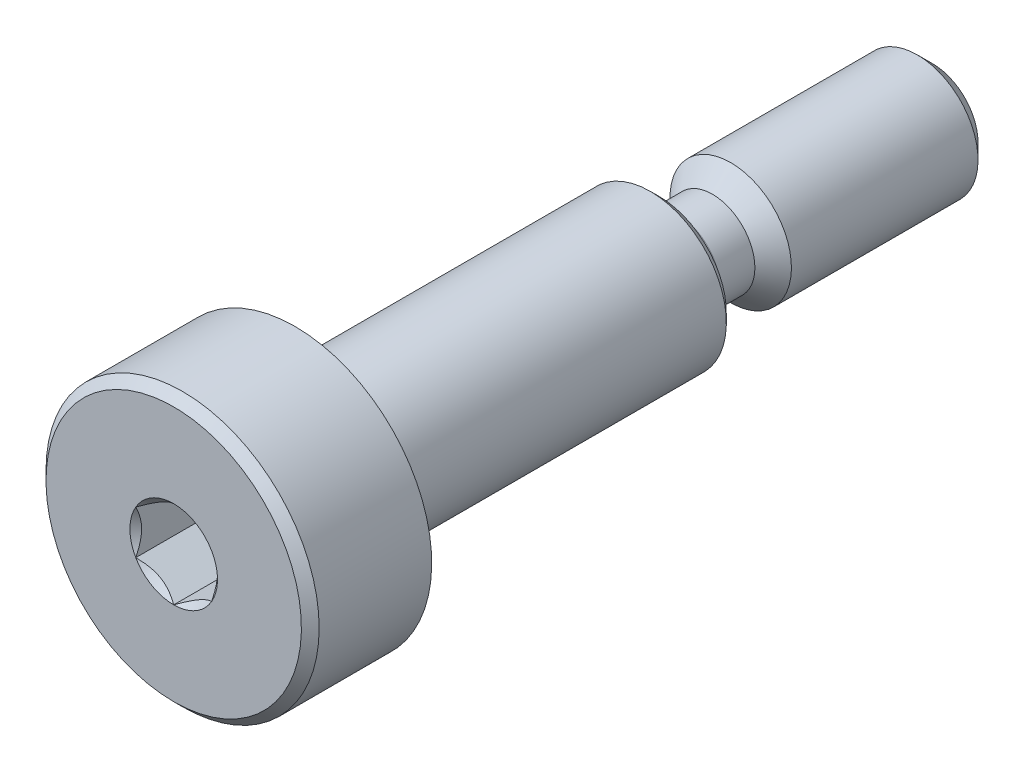
from build123d import *

# Parameters (mm, degrees)
SKETCH4_W           = 0.6
SKETCH4_H           = 0.6
CHAMFER1_SIZE       = 0.1625
CHAMFER2_SIZE       = 0.5
CHAMFER3_SIZE       = 0.2925
CUT_EXTRUDE1_DEPTH  = 2
SPLIT2_START        = -3.2075
SPLIT2_OUTLINE_R    = 4.5
SPLIT2_DEPTH        = 15.7075
SPLIT2_START_2      = 10.5
SPLIT2_3_DEPTH      = 2
SPLIT2_10_OUTLINE_R = 2.5
SPLIT2_10_DEPTH     = 10.945


with BuildPart() as part:
    # Sketch3 → Revolve1 (revolve)
    with BuildSketch(Plane(origin=(0, 0, 0), x_dir=(0, 0, -1), z_dir=(1, 0, 0))):
        Polygon((-12.5, 4.5), (-8.5, 4.5), (-8.5, 2.5), (3.5, 2.5), (3.5, 2), (12.5, 2), (12.5, 0), (-12.5, 0), align=None)
    revolve(axis=Axis((0, 0, -12.5), (0, 0, 1)))

    # Sketch4 → Cut-Revolve1 (revolve, cut)
    with BuildSketch(Plane(origin=(0, 0, 0), x_dir=(0, 0, -1), z_dir=(1, 0, 0))):
        with Locations((-8.2, 2.2)):
            Rectangle(SKETCH4_W, SKETCH4_H)
    revolve(axis=Axis((0, 0, -12.5), (0, 0, 1)), mode=Mode.SUBTRACT)

    # Chamfer1
    chamfer1_edges = [part.edges().sort_by_distance(p)[0] for p in [
        (0, -1.9, 7.9),
        (0, -2.5, 7.9),
    ]]
    chamfer(chamfer1_edges, length=CHAMFER1_SIZE)

    # Sketch6 → Cut-Revolve2 (revolve, cut)
    with BuildSketch(Plane(origin=(0, 0, 0), x_dir=(0, 0, -1), z_dir=(1, 0, 0))):
        with BuildLine():
            Line((3.5, 2.5), (6.352, 2.5))
            Line((6.352, 2.5), (5.25, 1.398))
            Line((5.25, 1.398), (4.102, 1.398))
            ThreePointArc((4.102, 1.398), (3.676321718, 1.574321718), (3.5, 2))
            Line((3.5, 2), (3.5, 2.5))
        make_face()
    revolve(axis=Axis((0, 0, -12.5), (0, 0, 1)), mode=Mode.SUBTRACT)

    # Chamfer2
    chamfer2_edges = [part.edges().sort_by_distance(p)[0] for p in [
        (0, -2, -12.5),
    ]]
    chamfer(chamfer2_edges, length=CHAMFER2_SIZE)

    # Chamfer3
    chamfer3_edges = [part.edges().sort_by_distance(p)[0] for p in [
        (0, -2.5, -3.5),
        (0, -4.5, 12.5),
    ]]
    chamfer(chamfer3_edges, length=CHAMFER3_SIZE)

    # Sketch8 → Cut-Extrude1 (cut)
    with BuildSketch(Plane.XY.offset(12.5)):
        Polygon((1.25, 0.721687836), (0, 1.443375673), (-1.25, 0.721687836), (-1.25, -0.721687836), (0, -1.443375673), (1.25, -0.721687836), align=None)
    extrude(amount=-CUT_EXTRUDE1_DEPTH, mode=Mode.SUBTRACT)

    # Cut-Extrude2 cone 1 section (through the dimple's axis) → Cut-Extrude2 (revolve, cut)
    with BuildSketch(Plane(origin=(0, 0, 12.5), x_dir=(0, -1, 0), z_dir=(1, 0, 0))):
        Polygon((0, 0), (1.443375673, 0), (0, 1.443375673), align=None)
    revolve(axis=Axis((0, 0, 12.5), (0, 0, -1)), mode=Mode.SUBTRACT)

    # Split2: read off the stored shape, not the designer's step
    # Split2 outline → Split2 (cut)
    with BuildSketch(Plane.XY.offset(SPLIT2_START)):
        Circle(SPLIT2_OUTLINE_R)
    extrude(amount=SPLIT2_DEPTH, mode=Mode.SUBTRACT)


with BuildPart() as body_2:
    # Split2 2 outline → Split2 2 (revolve)
    with BuildSketch(Plane.XZ):
        Polygon((0, 12.500000022), (0, 7.7375), (2.5, 7.7375), (2.3375, 7.9), (2.0625, 7.9), (1.9, 8.0625), (1.9, 8.5), (4.5, 8.5), (4.5, 12.2075), (4.2075, 12.5), (1.443375689, 12.500000017), align=None)
    revolve(axis=Axis((0, 0, 0), (0, 0, 1)))

    # Split2 3 outline → Split2 3 (cut)
    with BuildSketch(Plane.XY.offset(SPLIT2_START_2)):
        Polygon((1.25, -0.721687836), (1.25, 0.721687836), (0, 1.443375673), (-1.25, 0.721687836), (-1.25, -0.721687836), (0, -1.443375673), align=None)
    extrude(amount=SPLIT2_3_DEPTH, mode=Mode.SUBTRACT)

    # Split2 4: loft between two sections, ruled curve by curve
    split2_4_from = [
        Edge.make_three_point_arc((1.08239615, 0.624921709, 12.306467745), (0.624921709, 1.08239615, 12.306467745), (0, 1.249843418, 12.306467745)),
        Edge.make_line((0, 1.249843418, 12.306467745), (1.08239615, 0.624921709, 12.306467745)),
    ]
    split2_4_to = [
        Edge.make_three_point_arc((1.250000029, 0.721687853, 12.500000033), (0.721687853, 1.250000029, 12.500000033), (0, 1.443375706, 12.500000033)),
        Edge.make_line((0, 1.443375706, 12.500000033), (1.250000029, 0.721687853, 12.500000033)),
    ]
    split2_4 = Solid(Shell([*[Face.make_surface_from_curves(split2_4_from[k], split2_4_to[k]) for k in range(2)], Face(Wire(split2_4_from)), Face(Wire(split2_4_to))]))
    add(split2_4, mode=Mode.SUBTRACT)

    # Split2 5: loft between two sections, ruled curve by curve
    split2_5_from = [
        Edge.make_three_point_arc((0, 1.249843418, 12.306467745), (-0.624921709, 1.08239615, 12.306467745), (-1.08239615, 0.624921709, 12.306467745)),
        Edge.make_line((-1.08239615, 0.624921709, 12.306467745), (0, 1.249843418, 12.306467745)),
    ]
    split2_5_to = [
        Edge.make_three_point_arc((0, 1.443375706, 12.500000033), (-0.721687853, 1.250000029, 12.500000033), (-1.250000029, 0.721687853, 12.500000033)),
        Edge.make_line((-1.250000029, 0.721687853, 12.500000033), (0, 1.443375706, 12.500000033)),
    ]
    split2_5 = Solid(Shell([*[Face.make_surface_from_curves(split2_5_from[k], split2_5_to[k]) for k in range(2)], Face(Wire(split2_5_from)), Face(Wire(split2_5_to))]))
    add(split2_5, mode=Mode.SUBTRACT)

    # Split2 6: loft between two sections, ruled curve by curve
    split2_6_from = [
        Edge.make_three_point_arc((-1.082395782, 0.624921515, 12.306467329), (-1.249843002, -4.66e-07, 12.306467329), (-1.082395316, -0.624922322, 12.306467329)),
        Edge.make_line((-1.082395316, -0.624922322, 12.306467329), (-1.082395782, 0.624921515, 12.306467329)),
    ]
    split2_6_to = [
        Edge.make_three_point_arc((-1.249999991, 0.721687853, 12.5), (-1.443375673, -5.38e-07, 12.5), (-1.249999452, -0.721688785, 12.5)),
        Edge.make_line((-1.249999452, -0.721688785, 12.5), (-1.249999991, 0.721687853, 12.5)),
    ]
    split2_6 = Solid(Shell([*[Face.make_surface_from_curves(split2_6_from[k], split2_6_to[k]) for k in range(2)], Face(Wire(split2_6_from)), Face(Wire(split2_6_to))]))
    add(split2_6, mode=Mode.SUBTRACT)

    # Split2 7: loft between two sections, ruled curve by curve
    split2_7_from = [
        Edge.make_three_point_arc((-1.08239615, -0.624921709, 12.306467745), (-0.624921709, -1.08239615, 12.306467745), (0, -1.249843418, 12.306467745)),
        Edge.make_line((0, -1.249843418, 12.306467745), (-1.08239615, -0.624921709, 12.306467745)),
    ]
    split2_7_to = [
        Edge.make_three_point_arc((-1.250000029, -0.721687853, 12.500000033), (-0.721687853, -1.250000029, 12.500000033), (0, -1.443375706, 12.500000033)),
        Edge.make_line((0, -1.443375706, 12.500000033), (-1.250000029, -0.721687853, 12.500000033)),
    ]
    split2_7 = Solid(Shell([*[Face.make_surface_from_curves(split2_7_from[k], split2_7_to[k]) for k in range(2)], Face(Wire(split2_7_from)), Face(Wire(split2_7_to))]))
    add(split2_7, mode=Mode.SUBTRACT)

    # Split2 8: loft between two sections, ruled curve by curve
    split2_8_from = [
        Edge.make_three_point_arc((0, -1.249843418, 12.306467745), (0.624921709, -1.08239615, 12.306467745), (1.08239615, -0.624921709, 12.306467745)),
        Edge.make_line((1.08239615, -0.624921709, 12.306467745), (0, -1.249843418, 12.306467745)),
    ]
    split2_8_to = [
        Edge.make_three_point_arc((0, -1.443375706, 12.500000033), (0.721687853, -1.250000029, 12.500000033), (1.250000029, -0.721687853, 12.500000033)),
        Edge.make_line((1.250000029, -0.721687853, 12.500000033), (0, -1.443375706, 12.500000033)),
    ]
    split2_8 = Solid(Shell([*[Face.make_surface_from_curves(split2_8_from[k], split2_8_to[k]) for k in range(2)], Face(Wire(split2_8_from)), Face(Wire(split2_8_to))]))
    add(split2_8, mode=Mode.SUBTRACT)

    # Split2 9: loft between two sections, ruled curve by curve
    split2_9_from = [
        Edge.make_three_point_arc((1.082395316, -0.624922322, 12.306467329), (1.249843002, -4.66e-07, 12.306467329), (1.082395782, 0.624921515, 12.306467329)),
        Edge.make_line((1.082395782, 0.624921515, 12.306467329), (1.082395316, -0.624922322, 12.306467329)),
    ]
    split2_9_to = [
        Edge.make_three_point_arc((1.249999452, -0.721688785, 12.5), (1.443375673, -5.38e-07, 12.5), (1.249999991, 0.721687853, 12.5)),
        Edge.make_line((1.249999991, 0.721687853, 12.5), (1.249999452, -0.721688785, 12.5)),
    ]
    split2_9 = Solid(Shell([*[Face.make_surface_from_curves(split2_9_from[k], split2_9_to[k]) for k in range(2)], Face(Wire(split2_9_from)), Face(Wire(split2_9_to))]))
    add(split2_9, mode=Mode.SUBTRACT)


with BuildPart() as body_3:
    # Split2 10 outline → Split2 10 (new body)
    with BuildSketch(Plane.XY.offset(SPLIT2_START)):
        Circle(SPLIT2_10_OUTLINE_R)
    extrude(amount=SPLIT2_10_DEPTH)


solid = Compound([part.part, body_2.part, body_3.part])
